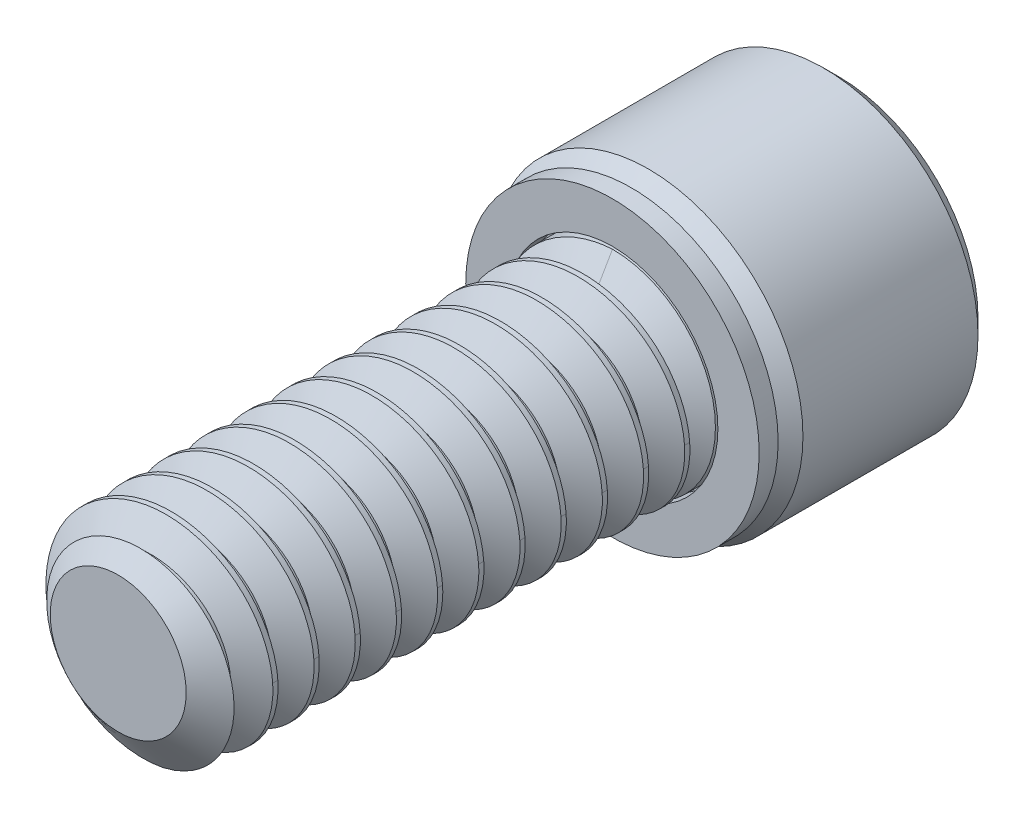
from build123d import *
from build123d.topology import SkipClean

# Parameters (mm, degrees)
SKETCH1_R           = 3.175
EXTRUDE1_DEPTH      = 15.875
CUT_SWEEP1_PITCH    = 1.27
SKETCH6_R           = 4.7625
EXTRUDE2_DEPTH      = 6.35
CUT_EXTRUDE1_DEPTH  = 3.571875
CHAMFER1_SIZE       = 0.47625
SKETCH11_R          = 3.175
BOSS_EXTRUDE1_DEPTH = 0.635
SKETCH12_R          = 3.175
BOSS_EXTRUDE2_DEPTH = 2.54
BOSS_EXTRUDE2_TAPER = 60
SKETCH14_R          = 4.524375
SKETCH14_R_2        = 3.2512
BOSS_EXTRUDE3_DEPTH = 0.5842


with BuildPart() as part:
    # Sketch1 → Extrude1 (new body)
    with BuildSketch(Plane.XY):
        Circle(SKETCH1_R)
    extrude(amount=-EXTRUDE1_DEPTH)

    # Cut-Sweep1: the profile of Sketch3 profile screwed along a right-hand helix of 13.5 turns, 6 arcs to a turn; built about Z, then put on its axis
    cut_sweep1_z = Axis((0, 0, 0), (0, 0, 1))
    cut_sweep1_corners = [(3.1753, 0, -1.111423205), (2.350110803, 0, -0.635), (2.350110803, 0, -0.47625), (3.1753, 0, 0.000173205)]
    with BuildLine(mode=Mode.PRIVATE) as cut_sweep1_profile:
        Line(cut_sweep1_corners[0], cut_sweep1_corners[1])
        Line(cut_sweep1_corners[1], cut_sweep1_corners[2])
        Line(cut_sweep1_corners[2], cut_sweep1_corners[3])
        Line(cut_sweep1_corners[3], cut_sweep1_corners[0])
    cut_sweep1_cap = Face(cut_sweep1_profile.wire())
    cut_sweep1_turn_angles = [0, 30, 60, 90, 120, 150, 180, 210, 240, 270, 300, 330, 360]
    cut_sweep1_turn_weights = [1, 0.8660254037844387, 1, 0.8660254037844387, 1, 0.8660254037844387, 1, 0.8660254037844387, 1, 0.8660254037844387, 1, 0.8660254037844387, 1]
    cut_sweep1_turn_rails = [Edge.make_bspline([Vector(p[0], p[1], 0).rotate(cut_sweep1_z, cut_sweep1_turn_angles[k]) / cut_sweep1_turn_weights[k] + Vector(0, 0, p[2] + CUT_SWEEP1_PITCH * cut_sweep1_turn_angles[k] / 360) for k in range(13)], [0, 0, 0, 1, 1, 2, 2, 3, 3, 4, 4, 5, 5, 6, 6, 6], 2, cut_sweep1_turn_weights) for p in cut_sweep1_corners]
    cut_sweep1_turn_sides = [Face.make_surface_from_curves(cut_sweep1_turn_rails[p[0]], cut_sweep1_turn_rails[p[1]]) for p in [(0, 1), (1, 2), (2, 3), (3, 0)]]
    cut_sweep1_last_angles = [4680, 4710, 4740, 4770, 4800, 4830, 4860]
    cut_sweep1_last_weights = [1, 0.8660254037844387, 1, 0.8660254037844387, 1, 0.8660254037843712, 1]
    cut_sweep1_last_rails = [Edge.make_bspline([Vector(p[0], p[1], 0).rotate(cut_sweep1_z, cut_sweep1_last_angles[k]) / cut_sweep1_last_weights[k] + Vector(0, 0, p[2] + CUT_SWEEP1_PITCH * cut_sweep1_last_angles[k] / 360) for k in range(7)], [0, 0, 0, 1, 1, 2, 2, 3, 3, 3], 2, cut_sweep1_last_weights) for p in cut_sweep1_corners]
    cut_sweep1_last_sides = [Face.make_surface_from_curves(cut_sweep1_last_rails[p[0]], cut_sweep1_last_rails[p[1]]) for p in [(0, 1), (1, 2), (2, 3), (3, 0)]]
    cut_sweep1 = Plane(origin=(0, 0, 0), x_dir=(0, 1, 0), z_dir=(0, 0, -1)) * Solid(Shell([*[p.moved(Location((0, 0, CUT_SWEEP1_PITCH * i))) for i in range(13) for p in cut_sweep1_turn_sides], *cut_sweep1_last_sides, cut_sweep1_cap, cut_sweep1_cap.rotate(cut_sweep1_z, 4860).moved(Location((0, 0, CUT_SWEEP1_PITCH * 4860 / 360)))]))
    add(cut_sweep1, mode=Mode.SUBTRACT)

    # Sketch4 → Cut-Revolve1 (revolve, cut)
    with BuildSketch(Plane(origin=(0, 0, 0), x_dir=(0, 0, -1), z_dir=(1, 0, 0)), mode=Mode.PRIVATE) as cut_revolve1_sk:
        Polygon((0.755446349, 3.175), (0, 2.096110803), (0, 3.175), align=None)
    revolve(cut_revolve1_sk.sketch.rotate(Axis((0, 0, 0), (0, 0, -1)), 229.892048011), axis=Axis((0, 0, 0), (0, 0, -1)), mode=Mode.SUBTRACT)

    # Sketch6 → Extrude2 (add)
    with BuildSketch(Plane(origin=(0, 0, -15.875), x_dir=(-1, 0, 0), z_dir=(0, 0, -1))):
        Circle(SKETCH6_R)
    extrude(amount=EXTRUDE2_DEPTH)

    # Sketch7 → Cut-Extrude1 (cut)
    with BuildSketch(Plane(origin=(0, 0, -22.225), x_dir=(-1, 0, 0), z_dir=(0, 0, -1))):
        Polygon((0, 2.749630657), (-2.38125, 1.374815329), (-2.38125, -1.374815329), (0, -2.749630657), (2.38125, -1.374815329), (2.38125, 1.374815329), align=None)
    extrude(amount=-CUT_EXTRUDE1_DEPTH, mode=Mode.SUBTRACT)

    # Cut-Extrude2 cone 1 section (through the dimple's axis) → Cut-Extrude2 (revolve, cut)
    with BuildSketch(Plane(origin=(0, 0, -22.225), x_dir=(0, 1, 0), z_dir=(1, 0, 0))):
        Polygon((0, 0), (2.749630657, 0), (0, 2.749630657), align=None)
    revolve(axis=Axis((0, 0, -22.225), (0, 0, 1)), mode=Mode.SUBTRACT)

    # Chamfer1
    chamfer1_edges = [part.edges().sort_by_distance(p)[0] for p in [
        (4.7625, 0, -15.875),
        (4.7625, 0, -22.225),
    ]]
    chamfer(chamfer1_edges, length=CHAMFER1_SIZE)



with BuildPart() as body_2:
    # Sketch11 → Boss-Extrude1 (new body)
    with BuildSketch(Plane.XY.offset(-15.875)):
        Circle(SKETCH11_R)
    extrude(amount=BOSS_EXTRUDE1_DEPTH)


with BuildPart() as part_1:
    with SkipClean():  # the faces are left unmerged after this step: merging them gives an invalid solid
        add(part.part)

        add(body_2.part)  # Boss-Extrude2 merges body 2
        # Sketch12 → Boss-Extrude2 (add)
        with BuildSketch(Plane.XY.offset(-15.24)):
            Circle(SKETCH12_R)
        extrude(amount=BOSS_EXTRUDE2_DEPTH, taper=BOSS_EXTRUDE2_TAPER)


with BuildPart() as body_2_2:
    # Sketch14 → Boss-Extrude3 (new body)
    with BuildSketch(Plane.XY.offset(-15.8242)):
        Circle(SKETCH14_R)
        Circle(SKETCH14_R_2, mode=Mode.SUBTRACT)
    extrude(amount=BOSS_EXTRUDE3_DEPTH)


solid = Compound([part_1.part, body_2_2.part])
